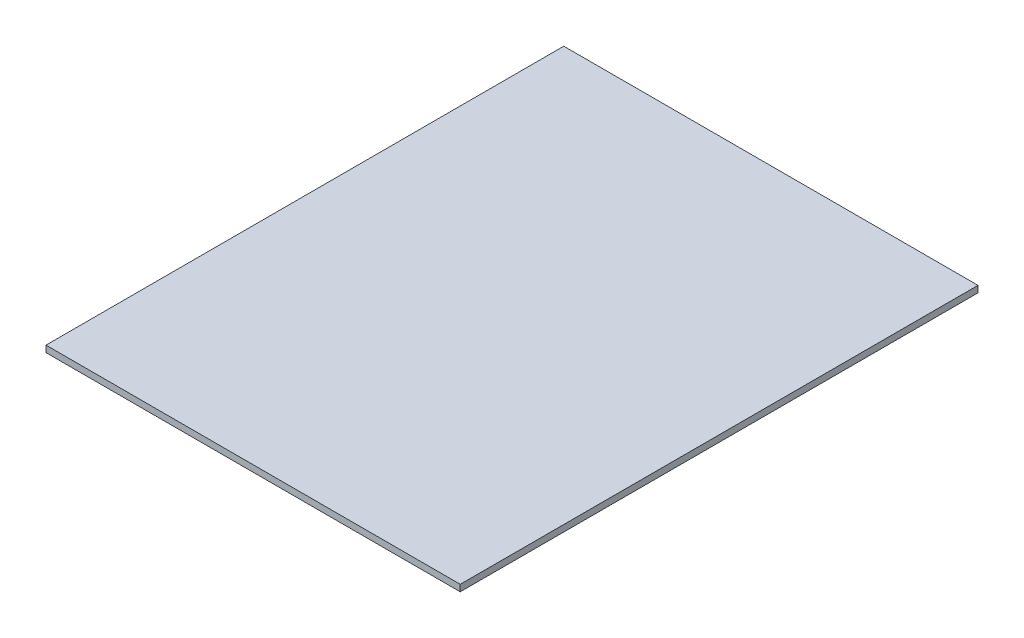
from build123d import *

# Parameters (mm, degrees)
SKETCH1_W           = 101.6
SKETCH1_H           = 127
BOSS_EXTRUDE1_DEPTH = 1.6


with BuildPart() as part:
    # Sketch1 → Boss-Extrude1 (new body)
    with BuildSketch(Plane(origin=(0, 0, 0), x_dir=(1, 0, 0), z_dir=(0, 1, 0))):
        Rectangle(SKETCH1_W, SKETCH1_H)
    extrude(amount=BOSS_EXTRUDE1_DEPTH)


solid = part.part
